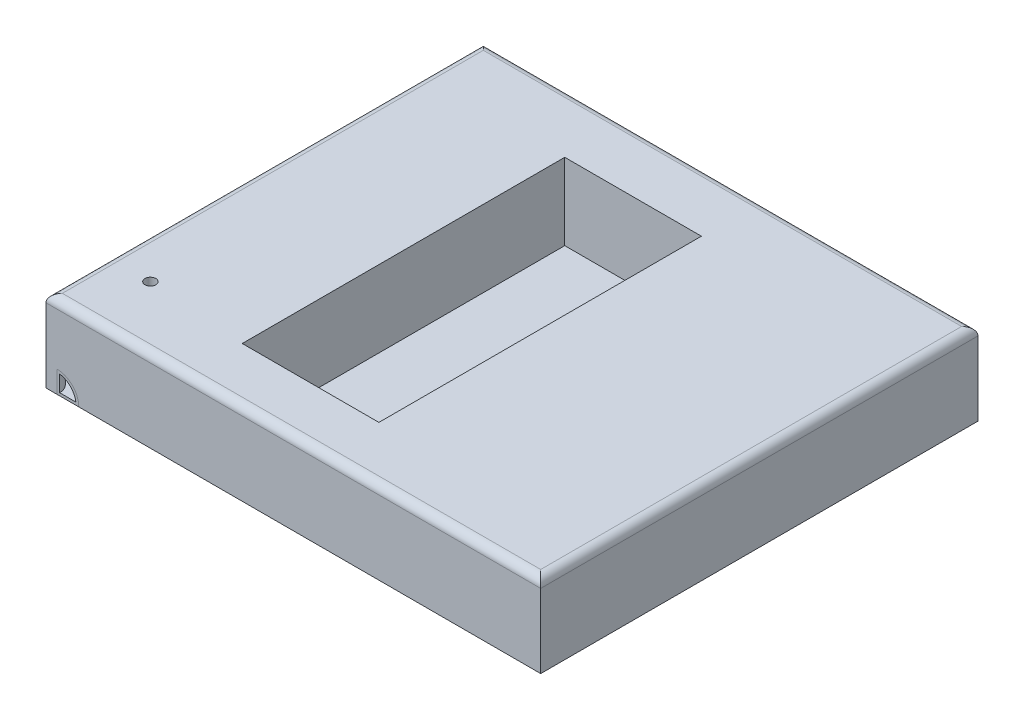
from build123d import *

# Parameters (mm, degrees)
SKETCH1_W            = 90.5
SKETCH1_H            = 80
BOSS_EXTRUDE1_DEPTH  = 15
SHELL3_T             = -1.5
CUT_EXTRUDE2_DEPTH   = 1.5
SKETCH6_W            = 13.15
SKETCH6_H            = 7.1
CUT_EXTRUDE3_DEPTH   = 1.5
SKETCH9_W            = 16.15
SKETCH9_H            = 1.55
BOSS_EXTRUDE2_DEPTH  = 1.5
FILLET7_R            = 1.5
SKETCH20_W           = 25
SKETCH20_H           = 59
BOSS_EXTRUDE8_DEPTH  = 14
SKETCH20_2_W         = 25
SKETCH20_2_H         = 59
CUT_EXTRUDE9_DEPTH   = 1.5
SHELL6_T             = 1
SKETCH21_W           = 1
SKETCH21_H           = 7.5
SKETCH21_H_2         = 8.5
BOSS_EXTRUDE9_DEPTH  = 13.5
SKETCH11_R           = 1
BOSS_EXTRUDE10_DEPTH = 10
SKETCH11_3_R         = 1
CUT_EXTRUDE10_DEPTH  = 1.5
SHELL9_T             = 1
CUT_REVOLVE4_ANGLE   = 90
REVOLVE3_ANGLE       = 90
SHELL14_T            = -0.5


with BuildPart() as part:
    # Sketch1 → Boss-Extrude1 (new body)
    with BuildSketch(Plane(origin=(0, 0, 0), x_dir=(1, 0, 0), z_dir=(0, 1, 0))):
        Rectangle(SKETCH1_W, SKETCH1_H)
    extrude(amount=BOSS_EXTRUDE1_DEPTH)

    # Shell3
    shell3_openings = [part.faces().sort_by_distance(p)[0] for p in [
        (0, 0, 0),
    ]]
    offset(amount=SHELL3_T, openings=shell3_openings, kind=Kind.INTERSECTION)

    # Sketch4 → Cut-Extrude2 (cut)
    with BuildSketch(Plane.ZY.offset(45.25)):
        with BuildLine():
            Line((-34.3, 3.2), (-28.56, 3.2))
            ThreePointArc((-28.56, 3.2), (-26.96, 1.6), (-28.56, 0))
            Line((-28.56, 0), (-34.3, 0))
            ThreePointArc((-34.3, 0), (-35.9, 1.6), (-34.3, 3.2))
        make_face()
    extrude(amount=-CUT_EXTRUDE2_DEPTH, mode=Mode.SUBTRACT)

    # Sketch6 → Cut-Extrude3 (cut)
    with BuildSketch(Plane.ZY.offset(45.25)):
        with Locations((-17.575, 3.55)):
            Rectangle(SKETCH6_W, SKETCH6_H)
    extrude(amount=-CUT_EXTRUDE3_DEPTH, mode=Mode.SUBTRACT)

    # Sketch9 → Boss-Extrude2 (add)
    with BuildSketch(Plane.ZY.offset(45.25)):
        with Locations((-17.575, 0.775)):
            Rectangle(SKETCH9_W, SKETCH9_H)
    extrude(amount=BOSS_EXTRUDE2_DEPTH)

    # Fillet7
    fillet7_edges = [part.edges().sort_by_distance(p)[0] for p in [
        (45.25, 15, 0),
        (0, 15, 40),
        (0, 15, -40),
        (-45.25, 15, 0),
    ]]
    fillet(fillet7_edges, radius=FILLET7_R)

    # Sketch20 → Boss-Extrude8 (add)
    with BuildSketch(Plane(origin=(0, 15, 0), x_dir=(1, 0, 0), z_dir=(0, 1, 0))):
        with Locations((-6.85, -0.5)):
            Rectangle(SKETCH20_W, SKETCH20_H)
    extrude(amount=-BOSS_EXTRUDE8_DEPTH)

    # Sketch20<2> → Cut-Extrude9 (cut)
    with BuildSketch(Plane(origin=(0, 15, 0), x_dir=(1, 0, 0), z_dir=(0, 1, 0))):
        with Locations((-6.85, -0.5)):
            Rectangle(SKETCH20_2_W, SKETCH20_2_H)
    extrude(amount=-CUT_EXTRUDE9_DEPTH, mode=Mode.SUBTRACT)


with BuildPart() as cut_extrude9_piece_1:
    # of the separate pieces the step leaves, piece 1, a body of its own (cut_extrude9_pieces)
    add(part.part.solids().sort_by_distance((-19.35, 1, -29))[0])

    # Shell6
    shell6_openings = [cut_extrude9_piece_1.faces().sort_by_distance(p)[0] for p in [
        (-6.85, 13.5, 0.5),
    ]]
    offset(amount=SHELL6_T, openings=shell6_openings, kind=Kind.INTERSECTION)



with BuildPart() as cut_extrude9_piece_2:
    # of the separate pieces the step leaves, piece 2, a body of its own (cut_extrude9_pieces)
    add(part.part.solids().sort_by_distance((-45.25, 13.5, 40))[0])


with BuildPart() as cut_extrude9_piece_1_1:
    add(cut_extrude9_piece_1.part)

    add(cut_extrude9_piece_2.part)  # Boss-Extrude9 merges Cut-Extrude9 piece 2
    # Sketch21 → Boss-Extrude9 (add)
    with BuildSketch(Plane(origin=(0, 13.5, 0), x_dir=(-1, 0, 0), z_dir=(0, -1, 0))):
        with Locations((-6.15, -34.75)):
            Rectangle(SKETCH21_W, SKETCH21_H)
        with Locations((-6.15, 34.25)):
            Rectangle(SKETCH21_W, SKETCH21_H_2)
    extrude(amount=BOSS_EXTRUDE9_DEPTH)

    # Sketch11 → Boss-Extrude10 (add)
    with BuildSketch(Plane(origin=(0, 15, 0), x_dir=(1, 0, 0), z_dir=(0, 1, 0))):
        with Locations((-37.55, -28.6)):
            Circle(SKETCH11_R)
    extrude(amount=-BOSS_EXTRUDE10_DEPTH)

    # Sketch11<3> → Cut-Extrude10 (cut)
    with BuildSketch(Plane(origin=(0, 15, 0), x_dir=(1, 0, 0), z_dir=(0, 1, 0))):
        with Locations((-37.55, -28.6)):
            Circle(SKETCH11_3_R)
    extrude(amount=-CUT_EXTRUDE10_DEPTH, mode=Mode.SUBTRACT)


with BuildPart() as cut_extrude10_piece_1:
    # of the separate pieces the step leaves, piece 1, a body of its own (cut_extrude10_pieces)
    add(cut_extrude9_piece_1_1.part.solids().sort_by_distance((-45.25, 13.5, 40))[0])

    # Sketch33 → Cut-Revolve4 (revolve, cut)
    with BuildSketch(Plane.XY.offset(40)):
        with BuildLine():
            Line((-43.25, 4), (-43.25, 0))
            Line((-43.25, 0), (-39.25, 0))
            ThreePointArc((-39.25, 0), (-40.421572875, 2.828427125), (-43.25, 4))
        make_face()
    revolve(axis=Axis((-45.25, 15, 40), (0, 1, 0)), revolution_arc=CUT_REVOLVE4_ANGLE, mode=Mode.SUBTRACT)


with BuildPart() as cut_extrude10_piece_2:
    # of the separate pieces the step leaves, piece 2, a body of its own (cut_extrude10_pieces)
    add(cut_extrude9_piece_1_1.part.solids().sort_by_distance((-36.55, 5, 28.6))[0])

    # Shell9
    shell9_openings = [cut_extrude10_piece_2.faces().sort_by_distance(p)[0] for p in [
        (-37.55, 5, 28.6),
        (-37.55, 13.5, 28.6),
    ]]
    offset(amount=SHELL9_T, openings=shell9_openings, kind=Kind.INTERSECTION)


with BuildPart() as body_3:
    # Sketch33<2> → Revolve3 (revolve)
    with BuildSketch(Plane.XY.offset(40)):
        with BuildLine():
            Line((-43.25, 4), (-43.25, 0))
            Line((-43.25, 0), (-39.25, 0))
            ThreePointArc((-39.25, 0), (-40.421572875, 2.828427125), (-43.25, 4))
        make_face()
    revolve(axis=Axis((-45.25, 15, 40), (0, 1, 0)), revolution_arc=REVOLVE3_ANGLE)

    # Shell14
    shell14_openings = [body_3.faces().sort_by_distance(p)[0] for p in [
        (-45.25, 1.697652726, 36.302347274),
        (-41.552347274, 1.697652726, 40),
    ]]
    offset(amount=SHELL14_T, openings=shell14_openings)


solid = Compound([cut_extrude10_piece_1.part, cut_extrude10_piece_2.part, body_3.part])
